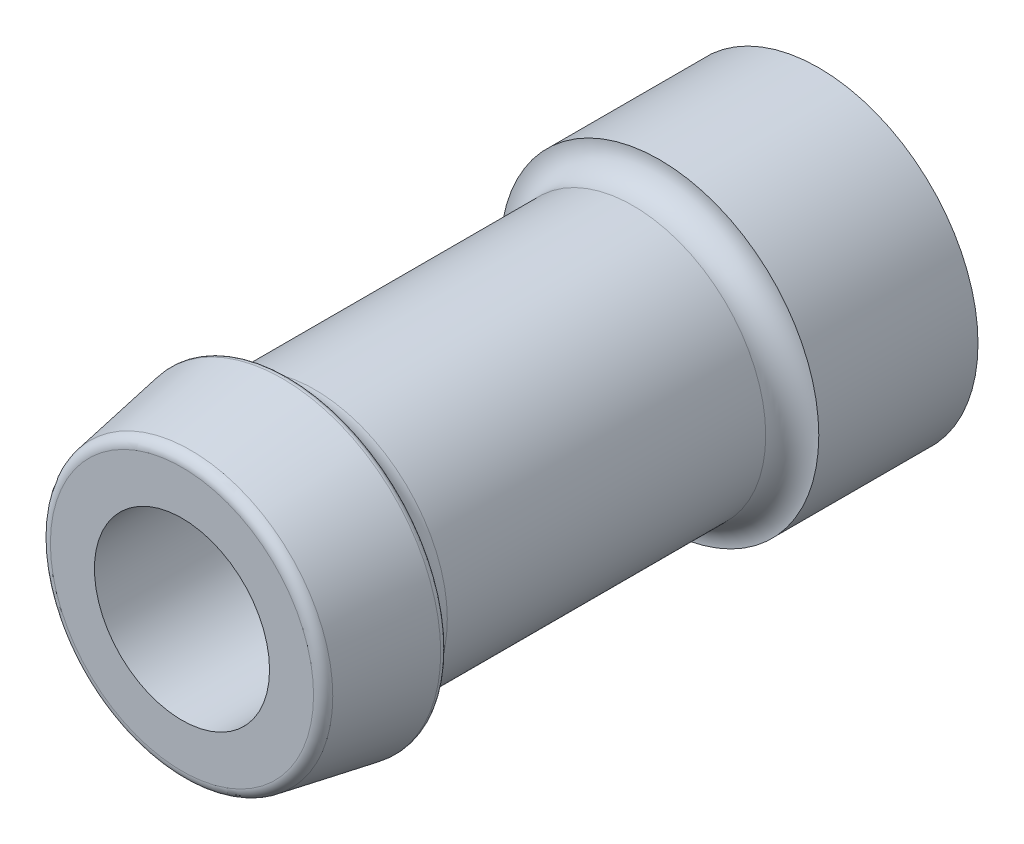
from build123d import *

# Parameters (mm, degrees)
SKETCH1_R           = 7.62
BOSS_EXTRUDE1_DEPTH = 30.48
SKETCH2_R           = 4.191
CUT_EXTRUDE1_DEPTH  = 30.48
CUT_EXTRUDE2_START  = -5.08
SKETCH3_R           = 10.16
SKETCH3_R_2         = 6.35
CUT_EXTRUDE2_DEPTH  = 17.78
FILLET1_R           = 1.27
FILLET2_R           = 1.27
CHAMFER1_SIZE       = 5.08
CHAMFER1_SIZE_2     = 0.895741062
FILLET3_R           = 0.508
FILLET4_R           = 0.254


# Some blends are built 0.0001 mm under size
with BuildPart() as part:
    # Sketch1 → Boss-Extrude1 (new body)
    with BuildSketch(Plane.XY):
        with Locations(Location((0, 0, 0), (0, 0, 180))):
            Circle(SKETCH1_R)
    extrude(amount=BOSS_EXTRUDE1_DEPTH)

    # Sketch2 → Cut-Extrude1 (cut)
    with BuildSketch(Plane.XY.offset(30.48)):
        Circle(SKETCH2_R)
    extrude(amount=-CUT_EXTRUDE1_DEPTH, mode=Mode.SUBTRACT)

    # Sketch3 → Cut-Extrude2 (cut)
    with BuildSketch(Plane.XY.offset(30.48).offset(CUT_EXTRUDE2_START)):
        Circle(SKETCH3_R)
        Circle(SKETCH3_R_2, mode=Mode.SUBTRACT)
    extrude(amount=-CUT_EXTRUDE2_DEPTH, mode=Mode.SUBTRACT)

    # Fillet1
    fillet1_edges = [part.edges().sort_by_distance(p)[0] for p in [
        (-6.35, 0, 7.62),
    ]]
    fillet(fillet1_edges, radius=FILLET1_R - 0.0001)  # a hair under: the kernel refuses the full size

    # Fillet2
    fillet2_edges = [part.edges().sort_by_distance(p)[0] for p in [
        (-6.35, 0, 25.4),
    ]]
    fillet(fillet2_edges, radius=FILLET2_R - 0.0001)  # a hair under: the kernel refuses the full size

    # Chamfer1
    # the kernel refuses this chamfer: 5.08, 0.895741062 mm, written as the material it takes off along each edge
    with BuildSketch(Plane(origin=(0, 0, 30.48), x_dir=(-1, 0, 0), z_dir=(0, 1, 0))) as chamfer1_piece_1:
        Polygon((7.62, -CHAMFER1_SIZE), (7.62 - CHAMFER1_SIZE_2, 0), (7.62, 0), align=None)
    revolve(axis=Axis((0, 0, 30.48), (0, 0, 1)), mode=Mode.SUBTRACT)

    # Fillet3
    fillet3_edges = [part.edges().sort_by_distance(p)[0] for p in [
        (6.724258938, 0, 30.48),
    ]]
    fillet(fillet3_edges, radius=FILLET3_R)

    # Fillet4
    fillet4_edges = [part.edges().sort_by_distance(p)[0] for p in [
        (7.62, 0, 25.4),
    ]]
    fillet(fillet4_edges, radius=FILLET4_R)


solid = part.part
